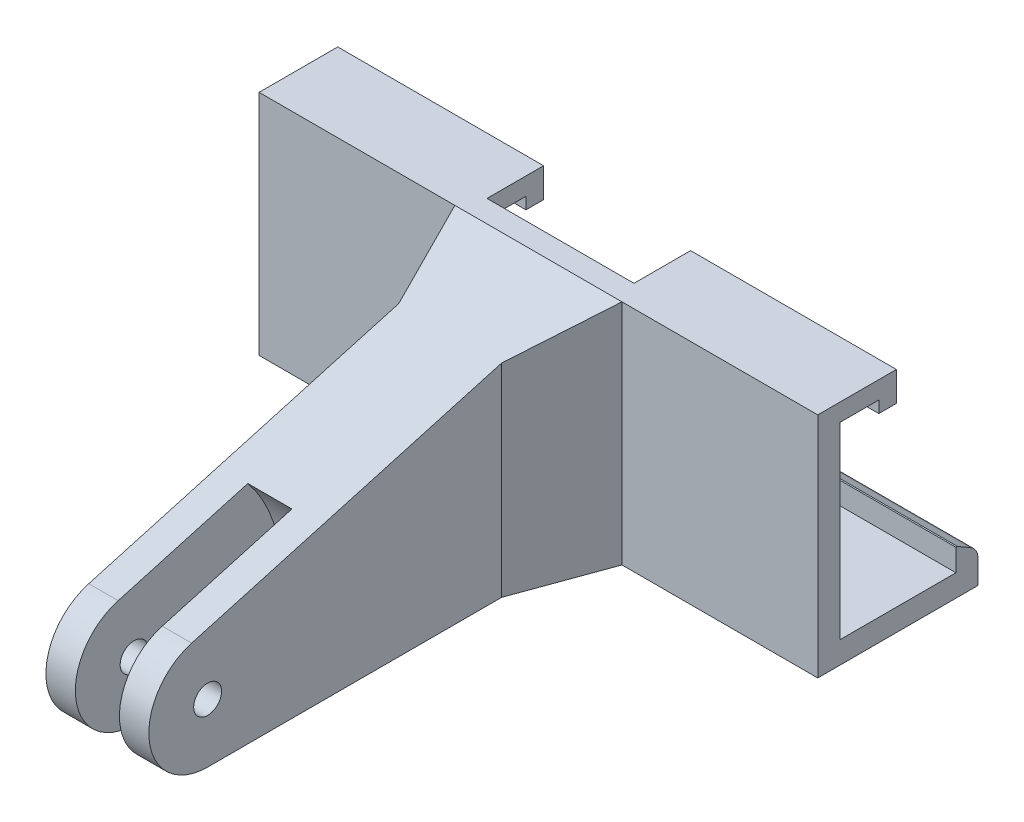
from build123d import *
from OCP.BRepFilletAPI import BRepFilletAPI_MakeChamfer

# Parameters (mm, degrees)
EXTRUDE_1_DEPTH     = 19
CUT_EXTRUDE_1_REACH = 28.26
SKETCH_6_W          = 20
SKETCH_6_H          = 6
CHAMFER_1_SIZE      = 1.4
CHAMFER_1_SIZE2     = 0.808290377
CUT_EXTRUDE_3_REACH = 28.26
SKETCH_9_W          = 10
SKETCH_9_H          = 3.85
FILLET_4_R          = 1
EXTRUDE_4_DEPTH     = 3.5
SKETCH_11_R         = 10
CUT_EXTRUDE_4_DEPTH = 1.5
CHAMFER_2_SIZE      = 6
CHAMFER_2_SIZE_2    = 2.183821406
SHELL_START         = -1.98
SHELL_4_DEPTH       = 3.96
SHELL_START_2       = 0.02
SHELL_4_2_DEPTH     = 12.394886134
SHELL_START_3       = 12.360630137
SHELL_4_3_DEPTH     = 1.52
SKETCH_12_R         = 0.95
CUT_EXTRUDE_5_DEPTH = 42.164304926


with BuildPart() as part:
    # 草圖1 → 填料-伸長1 (new, symmetric)
    with BuildSketch(Plane(origin=(0, 0, 0), x_dir=(0, 0, -1), z_dir=(1, 0, 0))):
        Polygon((0, 12.8), (0, 0), (7.9, 0), (7.9, 1.5), (9.4, 1.5), (9.4, -1.5), (-1.5, -1.5), (-1.5, 14), (3.85, 14), (3.85, 12), (2.65, 12), (2.65, 12.8), align=None)
    extrude(amount=EXTRUDE_1_DEPTH, both=True)

    # 草圖6 → 除料-伸長1 (cut, up to next)
    with BuildSketch(Plane(origin=(0, -1.5, 0), x_dir=(1, 0, 0), z_dir=(0, 1, 0)), mode=Mode.PRIVATE) as cut_extrude_1_sk1:
        with Locations((0, 6.4)):
            Rectangle(SKETCH_6_W, SKETCH_6_H)
    cut_extrude_1_tool1 = extrude(cut_extrude_1_sk1.sketch, amount=CUT_EXTRUDE_1_REACH, mode=Mode.PRIVATE) & part.part
    add(cut_extrude_1_tool1.solids().sort_by_distance((0, -1.5, -6.4))[0], mode=Mode.SUBTRACT)

    # 導角1: one chamfer whose edges measure the first distance from different faces: ONE call of the kernel's chamfer builder (chamfer() names one face for all edges)
    chamfer_1_edges_1 = [part.edges().sort_by_distance(p)[0] for p in [
        (14.5, 1.5, -9.4),
    ]]
    chamfer_1_side_1 = [part.faces().sort_by_distance(p)[0] for p in [
        (14.5, 1.5, -8.65),
    ]]
    chamfer_1_edges_2 = [part.edges().sort_by_distance(p)[0] for p in [
        (-14.5, 1.5, -9.4),
    ]]
    chamfer_1_side_2 = [part.faces().sort_by_distance(p)[0] for p in [
        (-14.5, 1.5, -8.65),
    ]]
    chamfer_1 = BRepFilletAPI_MakeChamfer(part.part.solid().wrapped)
    for e in chamfer_1_edges_1:
        chamfer_1.Add(CHAMFER_1_SIZE, CHAMFER_1_SIZE2, e.wrapped, chamfer_1_side_1[0].wrapped)  # the first distance lies on this face
    for e in chamfer_1_edges_2:
        chamfer_1.Add(CHAMFER_1_SIZE, CHAMFER_1_SIZE2, e.wrapped, chamfer_1_side_2[0].wrapped)  # the first distance lies on this face
    add(Compound.cast(chamfer_1.Shape()), mode=Mode.REPLACE)

    # 草圖9 → 除料-伸長3 (cut, up to next)
    with BuildSketch(Plane(origin=(0, 14, 0), x_dir=(1, 0, 0), z_dir=(0, 1, 0)), mode=Mode.PRIVATE) as cut_extrude_3_sk1:
        with Locations((0, 1.925)):
            Rectangle(SKETCH_9_W, SKETCH_9_H)
    cut_extrude_3_tool1 = extrude(cut_extrude_3_sk1.sketch, amount=-CUT_EXTRUDE_3_REACH, mode=Mode.PRIVATE) & part.part
    add(cut_extrude_3_tool1.solids().sort_by_distance((0, 14, -1.925))[0], mode=Mode.SUBTRACT)

    # 圓角4
    fillet_4_edges = [part.edges().sort_by_distance(p)[0] for p in [
        (14.5, 0.691709623, -9.4),
        (-14.5, 0.691709623, -9.4),
    ]]
    fillet(fillet_4_edges, radius=FILLET_4_R)

    # 草圖10 → 填料-伸長4 (add, symmetric)
    with BuildSketch(Plane(origin=(0, 0, 0), x_dir=(0, 0, -1), z_dir=(1, 0, 0))):
        with BuildLine():
            Line((-1.5, -1.5), (-27.5, -1.5))
            ThreePointArc((-27.5, -1.5), (-31.462172303, 1.951191618), (-28.587236685, 6.34940468))
            Line((-28.587236685, 6.34940468), (-1.5, 14))
            Line((-1.5, 14), (-1.5, -1.5))
        make_face()
    extrude(amount=EXTRUDE_4_DEPTH, both=True)

    # 草圖11 → 除料-伸長4 (cut, symmetric)
    with BuildSketch(Plane(origin=(0, 0, 0), x_dir=(0, 0, -1), z_dir=(1, 0, 0))):
        with Locations((-27.5, 2.5)):
            Circle(SKETCH_11_R)
    extrude(amount=CUT_EXTRUDE_4_DEPTH, both=True, mode=Mode.SUBTRACT)

    # 導角2
    # the kernel refuses this chamfer: 6, 2.183821406 mm, written as the material it adds along each edge
    with BuildSketch(Plane(origin=(-3.5, 14, 1.5), x_dir=(0, 0, 1), z_dir=(0, -1, 0))) as chamfer_2_piece_1_section:
        Polygon((CHAMFER_2_SIZE, 0), (0, CHAMFER_2_SIZE_2), (0, 0), align=None)
    chamfer_2_piece_1 = extrude(amount=15.5, mode=Mode.PRIVATE)
    chamfer_2_piece_1 = split(chamfer_2_piece_1, bisect_by=Plane(origin=(-3.5, 14, 1.5), z_dir=(0, -0.9623511699869516, -0.2718091713403826)), keep=Keep.TOP, mode=Mode.PRIVATE)
    add(chamfer_2_piece_1)
    with BuildSketch(Plane(origin=(3.5, 14, 1.5), x_dir=(0, 0, 1), z_dir=(0, -1, 0))) as chamfer_2_piece_2_section:
        Polygon((CHAMFER_2_SIZE, 0), (0, -CHAMFER_2_SIZE_2), (0, 0), align=None)
    chamfer_2_piece_2 = extrude(amount=15.5, mode=Mode.PRIVATE)
    chamfer_2_piece_2 = split(chamfer_2_piece_2, bisect_by=Plane(origin=(3.5, 14, 1.5), z_dir=(0, -0.9623511699869516, -0.2718091713403826)), keep=Keep.TOP, mode=Mode.PRIVATE)
    add(chamfer_2_piece_2)

    # 薄殼4: read off the stored shape, not the designer's step
    # 薄殼4 outline → 薄殼4 (cut)
    with BuildSketch(Plane.YZ.offset(SHELL_START)):
        with BuildLine():
            Line((0.02, 1.52), (12.414886134, 1.52))
            Line((12.414886134, 1.52), (7.944453878, 17.347743011))
            ThreePointArc((7.944453878, 17.347743011), (4.08056814, 16.088943767), (0.02, 16.250111112))
            Line((0.02, 16.250111112), (0.02, 1.52))
        make_face()
    extrude(amount=SHELL_4_DEPTH, mode=Mode.SUBTRACT)

    # Shell 4 2 outline → Shell 4 2 (cut)
    with BuildSketch(Plane(origin=(0, 0, 0), x_dir=(1, 0, 0), z_dir=(0, 1, 0)).offset(SHELL_START_2)):
        Polygon((4.058991787, -1.52), (1.98, -1.52), (1.98, -7.231982989), align=None)
        Polygon((-1.98, -1.52), (-4.058991787, -1.52), (-1.98, -7.231982989), align=None)
    extrude(amount=SHELL_4_2_DEPTH, mode=Mode.SUBTRACT)

    # Shell 4 3 outline → Shell 4 3 (add)
    with BuildSketch(Plane(origin=(0, 0, 0), x_dir=(1, 0, 0), z_dir=(0, 0.9623511699869516, 0.2718091713403829)).offset(SHELL_START_3)):
        Polygon((4.058991787, 1.911706134), (-4.058991787, 1.911706134), (-1.98, -4.023739437), (-1.98, -14.535245358), (1.98, -14.535245358), (1.98, -4.023739437), align=None)
    extrude(amount=SHELL_4_3_DEPTH)

    # 草圖12 → 除料-伸長5 (cut, through all)
    with BuildSketch(Plane(origin=(3.5, 0, 0), x_dir=(0, 0, -1), z_dir=(1, 0, 0))):
        with Locations((-27.5, 2.5)):
            Circle(SKETCH_12_R)
    extrude(amount=-CUT_EXTRUDE_5_DEPTH, mode=Mode.SUBTRACT)


solid = part.part
